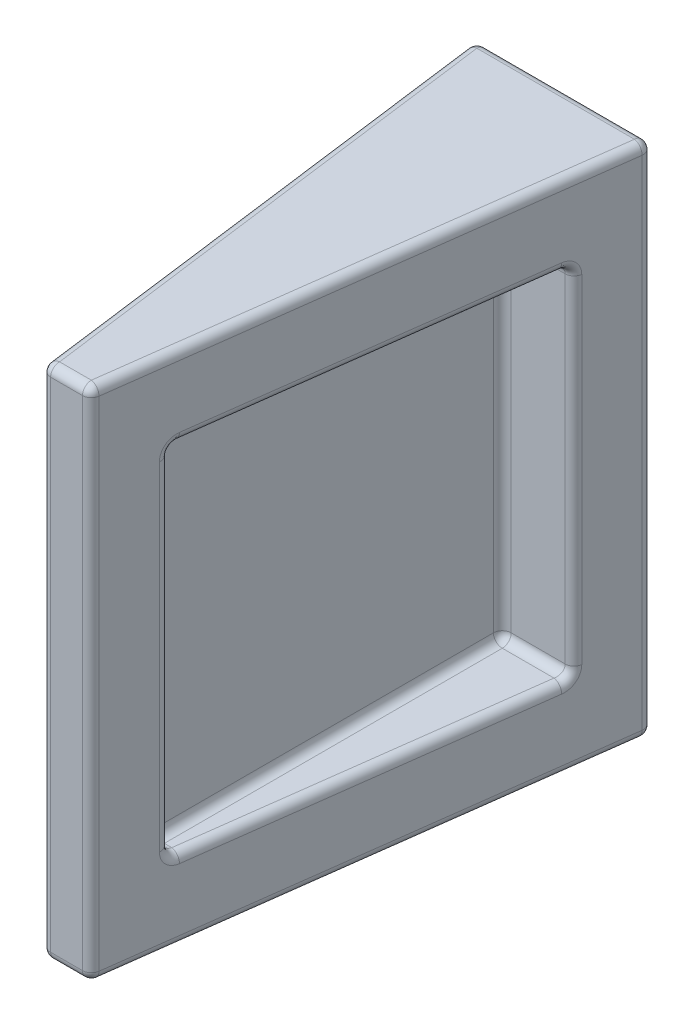
from build123d import *

# Parameters (mm, degrees)
A_FRAME_BODY_DEPTH        = 92.075
A_FRAME_BODY_DEPTH_BACK   = 92.075
FRONT_START               = 92.075
FRONT_WINDOW_SKETCH_W     = 127
FRONT_WINDOW_SKETCH_H     = 127
FRONT_WINDOW_POCKET_DEPTH = 88.9
BACK_START                = -92.075
BACK_WINDOW_SKETCH_W      = 127
BACK_WINDOW_SKETCH_H      = 127
BACK_WINDOW_POCKET_DEPTH  = 88.9
MOUNTING_HOLES_SKETCH_R   = 3.96875
MOUNTING_HOLES_DEPTH      = 12.7
EXTERNAL_FILLETS_R        = 3.175


with BuildPart() as part:
    # A-Frame Profile → A-Frame Body (new, two sides: drawn at the far end of the back side and taken through both)
    with BuildSketch(Plane(origin=(0, 0, 0), x_dir=(-1, 0, 0), z_dir=(0, 1, 0)).offset(-A_FRAME_BODY_DEPTH_BACK)):
        Polygon((-31.75, 0), (31.75, 0), (8.466666667, 177.8), (-8.466666667, 177.8), align=None)
    extrude(amount=A_FRAME_BODY_DEPTH + A_FRAME_BODY_DEPTH_BACK)

    # Front Window Sketch → Front Window Pocket (cut)
    with BuildSketch(Plane.YZ.offset(FRONT_START)):
        with Locations((0, 88.9)):
            Rectangle(FRONT_WINDOW_SKETCH_W, FRONT_WINDOW_SKETCH_H)
    extrude(amount=-FRONT_WINDOW_POCKET_DEPTH, mode=Mode.SUBTRACT)

    # Back Window Sketch → Back Window Pocket (cut)
    with BuildSketch(Plane.YZ.offset(BACK_START)):
        with Locations((0, 88.9)):
            Rectangle(BACK_WINDOW_SKETCH_W, BACK_WINDOW_SKETCH_H)
    extrude(amount=BACK_WINDOW_POCKET_DEPTH, mode=Mode.SUBTRACT)

    # Mounting Holes Sketch → Mounting Holes (cut)
    with BuildSketch(Plane(origin=(0, 0, 0), x_dir=(0, 1, 0), z_dir=(0, 0, 1))):
        with Locations((-31.75, 0)):
            Circle(MOUNTING_HOLES_SKETCH_R)
        with Locations((31.75, 0)):
            Circle(MOUNTING_HOLES_SKETCH_R)
    extrude(amount=MOUNTING_HOLES_DEPTH, mode=Mode.SUBTRACT)

    # External Fillets
    external_fillets_edges = [part.edges().sort_by_distance(p)[0] for p in [
        (0, 27.78125, 12.7),
        (0, 27.78125, 0),
        (0, -35.71875, 0),
        (0, -35.71875, 12.7),
        (-3.175, -63.5, 88.9),
        (-3.175, 0, 25.4),
        (-3.175, 63.5, 88.9),
        (-3.175, 0, 152.4),
        (-7.483928571, -63.5, 152.4),
        (-7.483928571, 63.5, 152.4),
        (-15.799404762, 63.5, 25.4),
        (-15.799404762, -63.5, 25.4),
        (3.175, -63.5, 88.9),
        (3.175, 0, 25.4),
        (3.175, 63.5, 88.9),
        (3.175, 0, 152.4),
        (15.799404762, -63.5, 25.4),
        (15.799404762, 63.5, 25.4),
        (7.483928571, 63.5, 152.4),
        (7.483928571, -63.5, 152.4),
        (20.108333333, 92.075, 88.9),
        (0, 92.075, 0),
        (-20.108333333, 92.075, 88.9),
        (0, 92.075, 177.8),
        (20.108333333, -92.075, 88.9),
        (0, -92.075, 0),
        (-20.108333333, -92.075, 88.9),
        (0, -92.075, 177.8),
        (31.75, 0, 0),
        (-31.75, 0, 0),
        (-8.466666667, 0, 177.8),
        (8.466666667, 0, 177.8),
        (28.423809524, 0, 25.4),
        (20.108333333, 63.5, 88.9),
        (11.792857143, 0, 152.4),
        (20.108333333, -63.5, 88.9),
        (-11.792857143, 0, 152.4),
        (-20.108333333, 63.5, 88.9),
        (-28.423809524, 0, 25.4),
        (-20.108333333, -63.5, 88.9),
    ]]
    fillet(external_fillets_edges, radius=EXTERNAL_FILLETS_R)


solid = part.part
